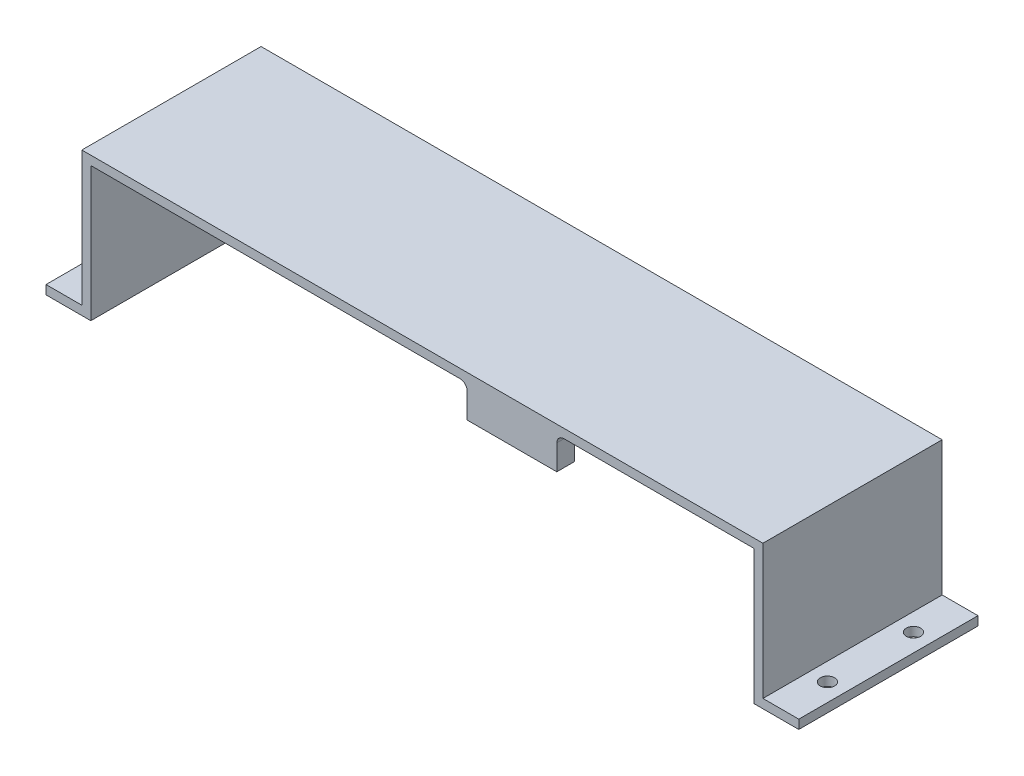
from build123d import *

# Parameters (mm, degrees)
SKETCH1_W           = 234.95
SKETCH1_H           = 63.5
BOSS_EXTRUDE1_DEPTH = 3.175
SKETCH3_W           = 3.175
SKETCH3_H           = 63.5
BOSS_EXTRUDE2_DEPTH = 50.8
SKETCH4_W           = 63.5
SKETCH4_H           = 3.175
BOSS_EXTRUDE3_DEPTH = 12.7
SKETCH5_R           = 2.54
CUT_EXTRUDE1_DEPTH  = 12.7
SKETCH6_W           = 31.75
SKETCH6_H           = 11.43
BOSS_EXTRUDE4_DEPTH = 6.35
FILLET1_R           = 2.54


with BuildPart() as part:
    # Sketch1 → Boss-Extrude1 (new body)
    with BuildSketch(Plane(origin=(0, 0, 0), x_dir=(1, 0, 0), z_dir=(0, 1, 0))):
        Rectangle(SKETCH1_W, SKETCH1_H)
    extrude(amount=BOSS_EXTRUDE1_DEPTH)

    # Sketch3 → Boss-Extrude2 (add)
    with BuildSketch(Plane(origin=(0, 3.175, 0), x_dir=(1, 0, 0), z_dir=(0, 1, 0))):
        with Locations((-119.0625, 0)):
            Rectangle(SKETCH3_W, SKETCH3_H)
        with Locations((119.0625, 0)):
            Rectangle(SKETCH3_W, SKETCH3_H)
    extrude(amount=-BOSS_EXTRUDE2_DEPTH)

    # Sketch4 → Boss-Extrude3 (add)
    with BuildSketch(Plane(origin=(120.65, 0, 0), x_dir=(0, 0, -1), z_dir=(1, 0, 0))):
        with Locations((0, -46.0375)):
            Rectangle(SKETCH4_W, SKETCH4_H)
    boss_extrude3 = extrude(amount=BOSS_EXTRUDE3_DEPTH)

    # Sketch5 → Cut-Extrude1 (cut)
    with BuildSketch(Plane.XZ.offset(47.625)):
        with Locations((127, -15.24)):
            Circle(SKETCH5_R)
        with Locations((127, 15.24)):
            Circle(SKETCH5_R)
    cut_extrude1 = extrude(amount=-CUT_EXTRUDE1_DEPTH, mode=Mode.SUBTRACT)

    # Mirror1: Boss-Extrude3, Cut-Extrude1 across plane
    add(boss_extrude3.mirror(Plane(origin=(0, 0, 0), x_dir=(0, 0, 1), z_dir=(1, 0, 0))))
    add(cut_extrude1.mirror(Plane(origin=(0, 0, 0), x_dir=(0, 0, 1), z_dir=(1, 0, 0))), mode=Mode.SUBTRACT)

    # Sketch6 → Boss-Extrude4 (add)
    with BuildSketch(Plane.XY.offset(31.75)):
        with Locations((31.75, -5.715)):
            Rectangle(SKETCH6_W, SKETCH6_H)
    extrude(amount=-BOSS_EXTRUDE4_DEPTH)

    # Fillet1
    fillet1_edges = [part.edges().sort_by_distance(p)[0] for p in [
        (47.625, 0, 28.575),
        (15.875, 0, 28.575),
    ]]
    fillet(fillet1_edges, radius=FILLET1_R)


solid = part.part
